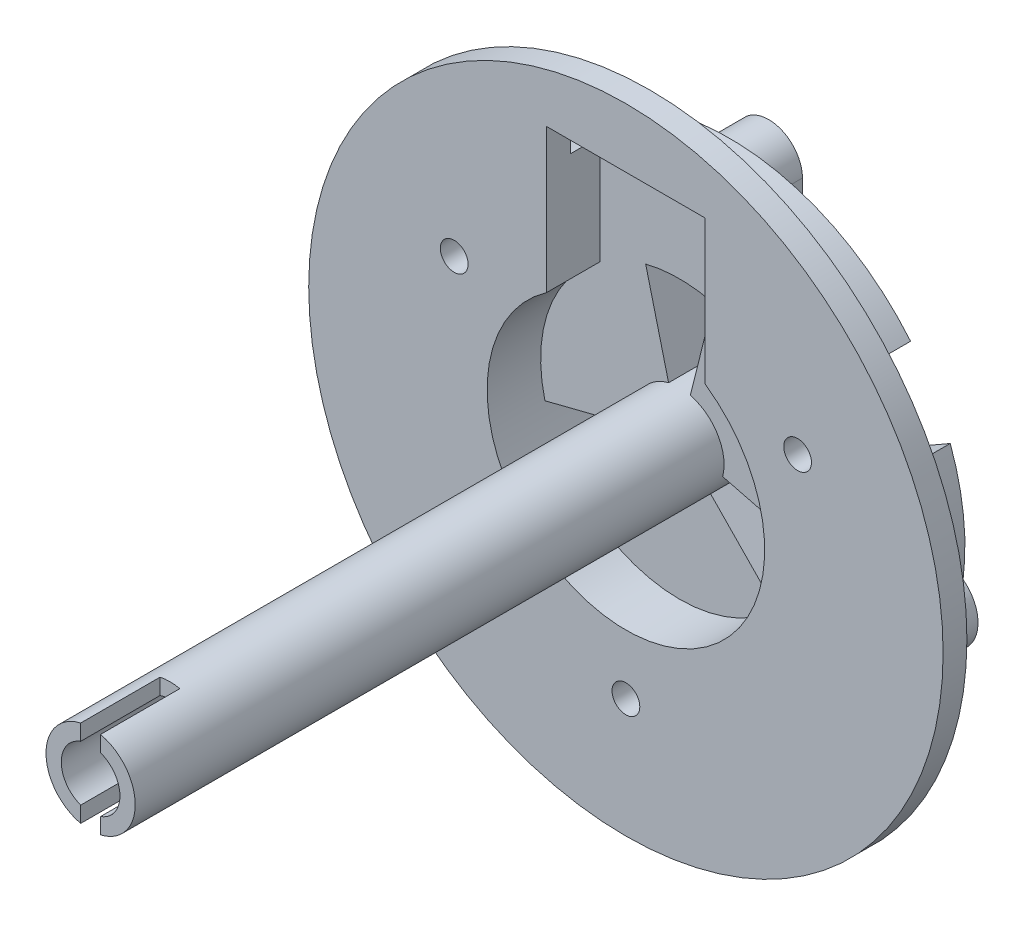
from build123d import *
from build123d.topology import SkipClean

# Parameters (mm, degrees)
SKETCH_1_R           = 16
EXTRUDE_1_DEPTH      = 1.2
SKETCH_2_R           = 7
CUT_EXTRUDE_1_DEPTH  = 1.2
SKETCH_3_R           = 0.7
CUT_EXTRUDE_2_DEPTH  = 1.2
SKETCH_4_R           = 0.9
EXTRUDE_2_DEPTH      = 6
SKETCH_5_R           = 7
CUT_EXTRUDE_3_DEPTH  = 11
SKETCH_6_R           = 11.9
SKETCH_6_R_2         = 7
EXTRUDE_3_DEPTH      = 4
SKETCH_7_R           = 0.7
CUT_EXTRUDE_4_DEPTH  = 13
SKETCH_8_R           = 2.25
EXTRUDE_4_DEPTH      = 33
EXTRUDE_START        = -2.5
EXTRUDE_5_DEPTH      = 2.5
SKETCH_10_R          = 1.5
CUT_EXTRUDE_5_DEPTH  = 33.5
SKETCH_12_W          = 13.813743992
SKETCH_12_H          = 10.461201588
CUT_EXTRUDE_6_DEPTH  = 16.75
SKETCH_13_R          = 2
CUT_EXTRUDE_7_DEPTH  = 1.5
SKETCH_14_R          = 2.25
SKETCH_14_R_2        = 1.5
EXTRUDE_6_DEPTH      = 8.25
CUT_EXTRUDE_9_DEPTH  = 1.5
EXTRUDE_START_2      = -32.2
SKETCH_17_R          = 1.5
SKETCH_17_R_2        = 1.48
EXTRUDE_7_DEPTH      = 32.2
CUT_EXTRUDE_8_DEPTH  = 4
CUT_EXTRUDE_10_DEPTH = 2.7


with BuildPart() as part:
    # 草图1 → 凸台-拉伸1 (new body)
    with BuildSketch(Plane.XY):
        Circle(SKETCH_1_R)
    extrude(amount=EXTRUDE_1_DEPTH)

    # 草图2 → 切除-拉伸1 (cut)
    with BuildSketch(Plane.XY.offset(1.2)):
        Circle(SKETCH_2_R)
    extrude(amount=-CUT_EXTRUDE_1_DEPTH, mode=Mode.SUBTRACT)

    # 草图3 → 切除-拉伸2 (cut)
    with BuildSketch(Plane.XY.offset(1.2)):
        with Locations((8.660254038, 5)):
            Circle(SKETCH_3_R)
        with Locations((0, -10)):
            Circle(SKETCH_3_R)
        with Locations((-8.660254038, 5)):
            Circle(SKETCH_3_R)
    extrude(amount=-CUT_EXTRUDE_2_DEPTH, mode=Mode.SUBTRACT)

    # 草图4 → 凸台-拉伸2 (add)
    # profile 1 of 3: a face of its own
    with BuildSketch(Plane(origin=(0, 0, 0), x_dir=(-1, 0, 0), z_dir=(0, 0, -1))):
        with BuildLine():
            Line((1.703894623, 10), (1.703894623, 5.395195442))
            Line((1.703894623, 5.395195442), (-1.703894623, 5.395195442))
            Line((-1.703894623, 5.395195442), (-1.703894623, 10))
            ThreePointArc((-1.703894623, 10), (0, 11.703894623), (1.703894623, 10))
        make_face()
        with Locations((0, 10)):
            Circle(SKETCH_4_R, mode=Mode.SUBTRACT)
    # profile 2 of 3: a face of its own
    with BuildSketch(Plane(origin=(0, 0, 0), x_dir=(-1, 0, 0), z_dir=(0, 0, -1))):
        with BuildLine():
            Line((-5.537946003, -1.003403593), (-3.637946003, -4.294300127))
            Line((-3.637946003, -4.294300127), (-7.710254038, -6.645448267))
            ThreePointArc((-7.710254038, -6.645448267), (-10.305702305, -5.95), (-9.610254038, -3.354551733))
            Line((-9.610254038, -3.354551733), (-5.537946003, -1.003403593))
        make_face()
        with Locations((-8.660254038, -5)):
            Circle(SKETCH_4_R, mode=Mode.SUBTRACT)
    # profile 3 of 3: a face of its own
    with BuildSketch(Plane(origin=(0, 0, 0), x_dir=(-1, 0, 0), z_dir=(0, 0, -1))):
        with BuildLine():
            Line((3.637946003, -4.294300127), (5.537946003, -1.003403593))
            Line((5.537946003, -1.003403593), (9.610254038, -3.354551733))
            ThreePointArc((9.610254038, -3.354551733), (10.305702305, -5.95), (7.710254038, -6.645448267))
            Line((7.710254038, -6.645448267), (3.637946003, -4.294300127))
        make_face()
        with Locations((8.660254038, -5)):
            Circle(SKETCH_4_R, mode=Mode.SUBTRACT)
    extrude(amount=EXTRUDE_2_DEPTH)

    # 草图5 → 切除-拉伸3 (cut)
    with BuildSketch(Plane.XY.offset(1.2)):
        Circle(SKETCH_5_R)
    extrude(amount=-CUT_EXTRUDE_3_DEPTH, mode=Mode.SUBTRACT)

    # 草图6 → 凸台-拉伸3 (add)
    with SkipClean():  # the faces are left unmerged after this step: merging them gives an invalid solid
        with BuildSketch(Plane(origin=(0, 0, 0), x_dir=(-1, 0, 0), z_dir=(0, 0, -1))):
            Circle(SKETCH_6_R)
            Circle(SKETCH_6_R_2, mode=Mode.SUBTRACT)
        extrude(amount=EXTRUDE_3_DEPTH)

    # 草图7 → 切除-拉伸4 (cut)
    with SkipClean():  # the faces are left unmerged after this step: merging them gives an invalid solid
        with BuildSketch(Plane.XY.offset(1.2)):
            with Locations((-8.660254038, 5)):
                Circle(SKETCH_7_R)
            with Locations((8.660254038, 5)):
                Circle(SKETCH_7_R)
            with Locations((0, -10)):
                Circle(SKETCH_7_R)
        extrude(amount=-CUT_EXTRUDE_4_DEPTH, mode=Mode.SUBTRACT)



with BuildPart() as body_2:
    # 草图8 → 凸台-拉伸4 (new body)
    with BuildSketch(Plane(origin=(0, 0, -4), x_dir=(-1, 0, 0), z_dir=(0, 0, -1))):
        Circle(SKETCH_8_R)
    extrude(amount=-EXTRUDE_4_DEPTH)


with BuildPart() as part_1:
    with SkipClean():  # the faces are left unmerged after this step: merging them gives an invalid solid
        add(part.part)

        add(body_2.part)  # 凸台-拉伸5 merges body 2
        # 草图9 → 凸台-拉伸5 (add)
        with BuildSketch(Plane(origin=(0, 0, -4), x_dir=(-1, 0, 0), z_dir=(0, 0, -1)).offset(EXTRUDE_START)):
            with BuildLine():
                Line((-1.570048426, -1.611659996), (-4.884595102, -5.01405332))
                ThreePointArc((-4.884595102, -5.01405332), (0, -7), (4.884595102, -5.01405332))
                Line((4.884595102, -5.01405332), (1.570048426, -1.611659996))
                ThreePointArc((1.570048426, -1.611659996), (0, -2.25), (-1.570048426, -1.611659996))
            make_face()
            with BuildLine():
                Line((-2.180762711, -0.553871824), (-6.784595102, -1.723156785))
                ThreePointArc((-6.784595102, -1.723156785), (-6.010804278, 3.587510548), (-1.703894623, 6.789458234))
                Line((-1.703894623, 6.789458234), (-0.547680415, 2.182325861))
                ThreePointArc((-0.547680415, 2.182325861), (-1.932044232, 1.15312839), (-2.180762711, -0.553871824))
            make_face()
            with BuildLine():
                Line((0.547680415, 2.182325861), (1.703894623, 6.789458234))
                ThreePointArc((1.703894623, 6.789458234), (6.010804278, 3.587510548), (6.784595102, -1.723156785))
                Line((6.784595102, -1.723156785), (2.180762711, -0.553871824))
                ThreePointArc((2.180762711, -0.553871824), (1.932044232, 1.15312839), (0.547680415, 2.182325861))
            make_face()
        extrude(amount=EXTRUDE_5_DEPTH)

    # 草图10 → 切除-拉伸5 (cut)
    with SkipClean():  # the faces are left unmerged after this step: merging them gives an invalid solid
        with BuildSketch(Plane(origin=(0, 0, -4), x_dir=(-1, 0, 0), z_dir=(0, 0, -1))):
            Circle(SKETCH_10_R)
        extrude(amount=-CUT_EXTRUDE_5_DEPTH, mode=Mode.SUBTRACT)

    # 草图12 → 切除-拉伸6 (cut, symmetric)
    with SkipClean():  # the faces are left unmerged after this step: merging them gives an invalid solid
        with BuildSketch(Plane(origin=(0, 0, 0), x_dir=(0, 0, -1), z_dir=(1, 0, 0))):
            with Locations((-26.856871996, 0.140862114)):
                Rectangle(SKETCH_12_W, SKETCH_12_H)
        extrude(amount=CUT_EXTRUDE_6_DEPTH, both=True, mode=Mode.SUBTRACT)

    # 草图13 → 切除-拉伸7 (cut)
    with SkipClean():  # the faces are left unmerged after this step: merging them gives an invalid solid
        with BuildSketch(Plane(origin=(0, 0, -4), x_dir=(-1, 0, 0), z_dir=(0, 0, -1))):
            with Locations((0, -10)):
                Circle(SKETCH_13_R)
            with Locations((8.660254038, 5)):
                Circle(SKETCH_13_R)
            with Locations((-8.660254038, 5)):
                Circle(SKETCH_13_R)
        extrude(amount=-CUT_EXTRUDE_7_DEPTH, mode=Mode.SUBTRACT)

    # 草图14 → 凸台-拉伸6 (add)
    with SkipClean():  # the faces are left unmerged after this step: merging them gives an invalid solid
        with BuildSketch(Plane.XY.offset(19.95)):
            Circle(SKETCH_14_R)
            Circle(SKETCH_14_R_2, mode=Mode.SUBTRACT)
        extrude(amount=EXTRUDE_6_DEPTH)

    # 草图16 → 切除-拉伸9 (cut)
    with SkipClean():  # the faces are left unmerged after this step: merging them gives an invalid solid
        with BuildSketch(Plane(origin=(0, 0, -4), x_dir=(-1, 0, 0), z_dir=(0, 0, -1))):
            Polygon((0, -10), (-2, -10), (-2, -14.130337011), (2, -14.130337011), (2, -10), align=None)
            Polygon((-9.660254038, 3.267949192), (-8.660254038, 5), (-7.660254038, 6.732050808), (-11.237230815, 8.797219313), (-13.237230815, 5.333117698), align=None)
            Polygon((7.660254038, 6.732050808), (8.660254038, 5), (9.660254038, 3.267949192), (13.237230815, 5.333117698), (11.237230815, 8.797219313), align=None)
        extrude(amount=-CUT_EXTRUDE_9_DEPTH, mode=Mode.SUBTRACT)

    # 草图17 → 凸台-拉伸7 (add)
    with SkipClean():  # the faces are left unmerged after this step: merging them gives an invalid solid
        with BuildSketch(Plane.XY.offset(28.2).offset(EXTRUDE_START_2)):
            Circle(SKETCH_17_R)
            Circle(SKETCH_17_R_2, mode=Mode.SUBTRACT)
        extrude(amount=EXTRUDE_7_DEPTH)

    # 草图15 → 切除-拉伸8 (cut)
    with SkipClean():  # the faces are left unmerged after this step: merging them gives an invalid solid
        with BuildSketch(Plane.XY.offset(28.2)):
            Polygon((0.5, 0), (0.5, 3.091484403), (-0.5, 3.091484403), (-0.5, -2.900632705), (0.5, -2.900632705), align=None)
        extrude(amount=-CUT_EXTRUDE_8_DEPTH, mode=Mode.SUBTRACT)

    # 草图18 → 切除-拉伸10 (cut)
    with SkipClean():  # the faces are left unmerged after this step: merging them gives an invalid solid
        with BuildSketch(Plane.XY.offset(1.2)):
            Polygon((0, 13), (-4, 13), (-4, 4.729732775), (4, 4.729732775), (4, 13), align=None)
        extrude(amount=-CUT_EXTRUDE_10_DEPTH, mode=Mode.SUBTRACT)


solid = part_1.part
